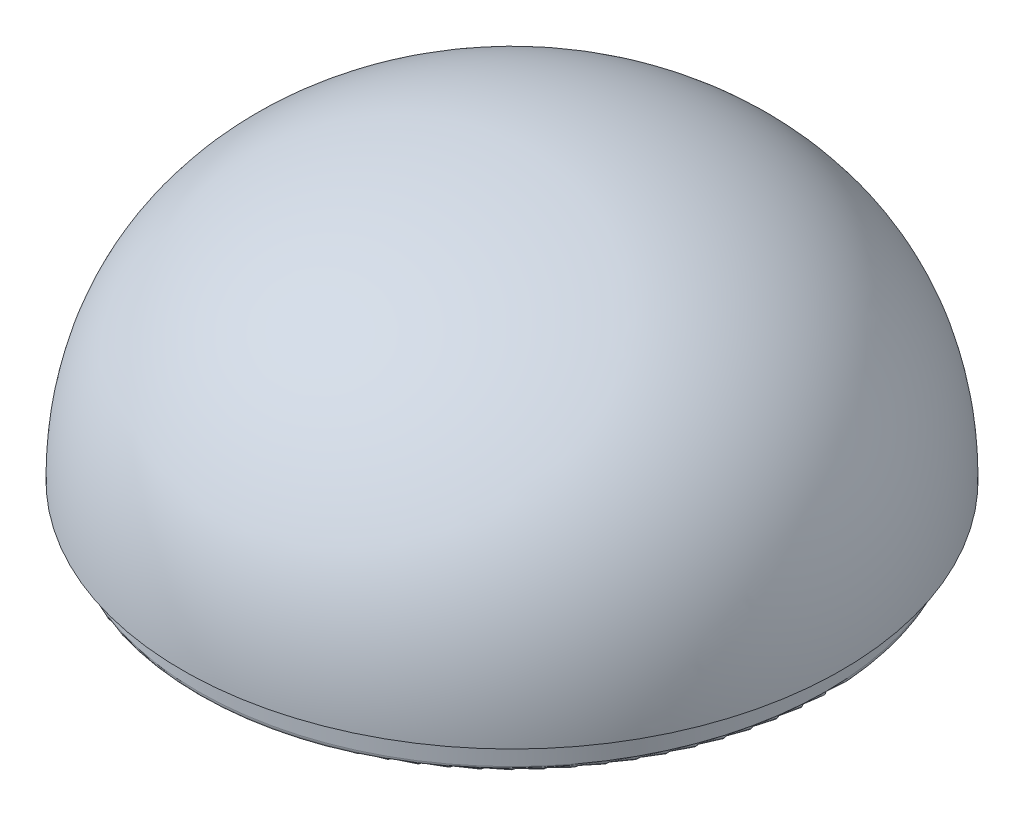
from build123d import *

# Parameters (mm, degrees)
FILLET1_R = 0.5


with BuildPart() as part:
    # Sketch2 → Revolve1 (revolve)
    with BuildSketch(Plane.XY):
        with BuildLine():
            Line((-29.7, 0), (-28.7, 0))
            Line((-28.7, 0), (-28.7, 3))
            Line((-28.7, 3), (-29.7, 4))
            Line((-29.7, 4), (-30.184026904, 4))
            add(Edge.make_bspline(
                [(-30.184026904, 4), (-30.166623492, 4.54069605), (-30.101486192, 5.634791729), (-29.85987076, 7.705122509), (-29.354955902, 10.152548026), (-28.451009727, 12.848310996), (-26.880303632, 16.14102408), (-24.288807456, 19.707939202), (-20.346681081, 23.158657086), (-15.748479669, 25.805349854), (-10.689451806, 27.666671311), (-5.353447893, 28.762877066), (-1.787836999, 29), (0, 29)],
                knots=[0.018366947, 0.018366947, 0.018366947, 0.018366947, 0.04904298, 0.079719013, 0.141071079, 0.202423145, 0.263775211, 0.386479342, 0.509183474, 0.631887605, 0.754591737, 0.877295868, 1, 1, 1, 1], degree=3))
            Line((0, 29), (0, 30))
            add(Edge.make_bspline(
                [(-31.2, 3), (-31.2, 21.931598134), (-14.795104957, 30), (0, 30)],
                knots=[0, 0, 0, 0, 1, 1, 1, 1], degree=3))
            Line((-31.2, 3), (-29.7, 3))
            Line((-29.7, 3), (-29.7, 0))
        make_face()
    revolve(axis=Axis((0, 0, 0), (0, 1, 0)))

    # Fillet1
    fillet1_edges = [part.edges().sort_by_distance(p)[0] for p in [
        (29.7, 0, 0),
    ]]
    fillet(fillet1_edges, radius=FILLET1_R)


solid = part.part
